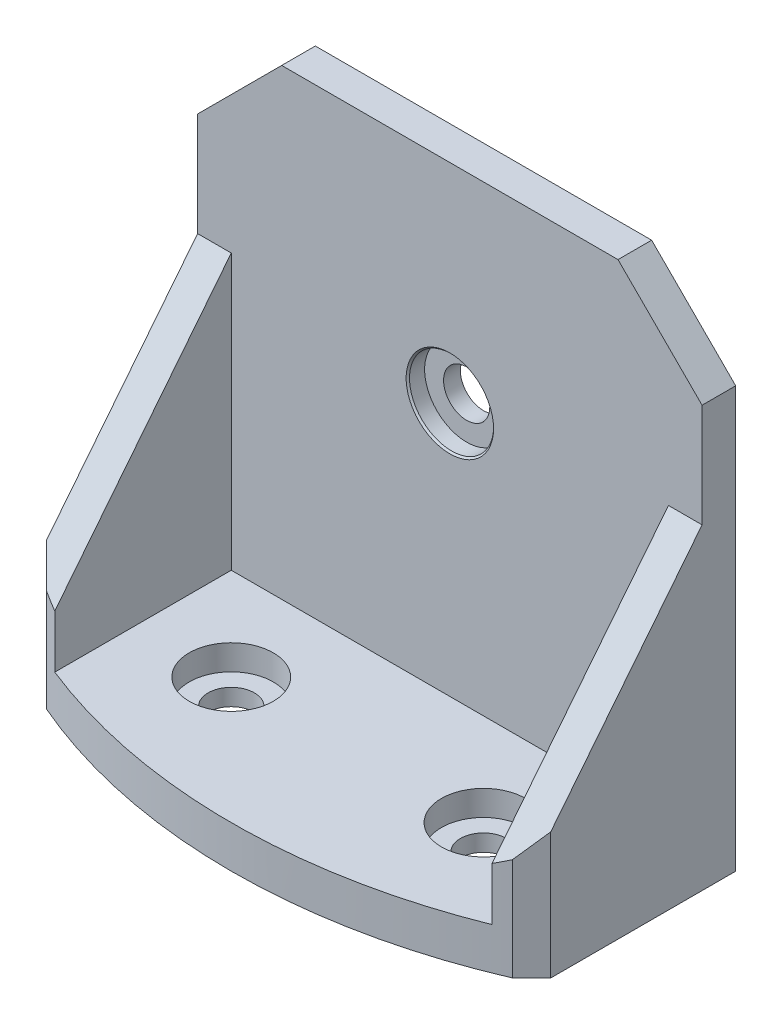
from build123d import *

# Parameters (mm, degrees)
SKETCH1_W                = 120
SKETCH1_H                = 30
BOSS_EXTRUDE1_DEPTH      = 100
CUT_EXTRUDE1_DEPTH       = 121.415945788
CUT_EXTRUDE1_DEPTH_BACK  = 121.415945788
SKETCH2_R                = 2.15
SKETCH2_W                = 20.1
SKETCH2_H                = 40.4
SKETCH3_OUTSIDE_W        = 153.812
SKETCH3_OUTSIDE_H        = 133.812
CUT_EXTRUDE2_DEPTH       = 121.415945788
CUT_EXTRUDE3_START       = -30
CUT_EXTRUDE3_DEPTH       = 30
SKETCH5_W                = 67.698745078
SKETCH5_H                = 100.8
CUT_EXTRUDE4_DEPTH       = 26
RIB1_REACH               = 122.416
SKETCH6_WALL_W           = 284.590065176
SKETCH6_WALL_H           = 4
RIB6_REACH               = 122.416
SKETCH7_WALL_W           = 284.590065176
SKETCH7_WALL_H           = 4
BOSS_EXTRUDE2_DEPTH      = 5
BOSS_EXTRUDE2_DEPTH_BACK = 4
SKETCH8_R                = 2.15
CUT_EXTRUDE5_DEPTH       = 84.326168543
CUT_EXTRUDE5_DEPTH_BACK  = 84.326168543
SKETCH9_R                = 2.75
SKETCH10_R               = 5
CUT_EXTRUDE6_DEPTH       = 3
CHAMFER1_SIZE            = 8
CUT_EXTRUDE7_START       = -12.194246874
CUT_EXTRUDE7_DEPTH       = 12.194246874
SKETCH12_W               = 37.282730079
SKETCH12_H               = 58.292887361
CUT_EXTRUDE8_DEPTH       = 108.591821251
SKETCH13_W               = 20.1
SKETCH13_H               = 40.4
BOSS_EXTRUDE3_DEPTH      = 4
SKETCH16_W               = 60
SKETCH16_H               = 40
BOSS_EXTRUDE4_DEPTH      = 4
CUT_EXTRUDE9_DEPTH       = 109.484577329
CUT_EXTRUDE9_DEPTH_BACK  = 109.484577329
SKETCH14_R               = 2.75
SKETCH15_R               = 5
CUT_EXTRUDE10_DEPTH      = 2
CHAMFER2_SIZE            = 0.2
CHAMFER3_SIZE            = 10
CUT_EXTRUDE11_DEPTH      = 109.484577329
CUT_EXTRUDE11_DEPTH_BACK = 109.484577329
CHAMFER4_SIZE            = 10


# Read off the part's stored shape, not the designer's step: Cut-Extrude3, Cut-Extrude7
with BuildPart() as part:
    # Sketch1 → Boss-Extrude1 (new body)
    with BuildSketch(Plane(origin=(0, 0, 0), x_dir=(1, 0, 0), z_dir=(0, 1, 0))):
        with Locations((0, -15)):
            Rectangle(SKETCH1_W, SKETCH1_H)
    extrude(amount=BOSS_EXTRUDE1_DEPTH)

    # Sketch2 → Cut-Extrude1 (cut, two sides: drawn at the far end of the back side and taken through both)
    with BuildSketch(Plane.XY.offset(30).offset(-CUT_EXTRUDE1_DEPTH_BACK)):
        with Locations((-4.95, 82.583541889)):
            Circle(SKETCH2_R)
        with Locations((4.95, 82.583541889)):
            Circle(SKETCH2_R)
        with Locations((-4.95, 34.383541889)):
            Circle(SKETCH2_R)
        with Locations((4.95, 34.383541889)):
            Circle(SKETCH2_R)
        with Locations((0, 58.483541889)):
            Rectangle(SKETCH2_W, SKETCH2_H)
    extrude(amount=CUT_EXTRUDE1_DEPTH + CUT_EXTRUDE1_DEPTH_BACK, mode=Mode.SUBTRACT)

    # Sketch3 outside → Cut-Extrude2 (cut, through all)
    with BuildSketch(Plane.XY.offset(30)):
        with Locations((0, 50)):
            Rectangle(SKETCH3_OUTSIDE_W, SKETCH3_OUTSIDE_H)
        with BuildLine():
            Line((-45, 23.283541889), (45, 23.283541889))
            Line((45, 23.283541889), (19.804596008, 86.568297014))
            ThreePointArc((19.804596008, 86.568297014), (0, 100), (-19.804596008, 86.568297014))
            Line((-19.804596008, 86.568297014), (-45, 23.283541889))
        make_face(mode=Mode.SUBTRACT)
    extrude(amount=-CUT_EXTRUDE2_DEPTH, mode=Mode.SUBTRACT)

    # Cut-Extrude3 outline → Cut-Extrude3 (cut)
    with BuildSketch(Plane.XY.offset(30).offset(CUT_EXTRUDE3_START)):
        Polygon((30, 60.95991045), (30, 23.283541889), (45, 23.283541889), align=None)
        Polygon((-30, 23.283541889), (-30, 60.95991045), (-45, 23.283541889), align=None)
    extrude(amount=CUT_EXTRUDE3_DEPTH, mode=Mode.SUBTRACT)

    # Sketch5 → Cut-Extrude4 (cut)
    with BuildSketch(Plane.XY.offset(30)):
        with Locations((0, 78.683541889)):
            Rectangle(SKETCH5_W, SKETCH5_H)
    extrude(amount=-CUT_EXTRUDE4_DEPTH, mode=Mode.SUBTRACT)

    # Sketch6 wall → Rib1 (add, up to next)
    with BuildSketch(Plane(origin=(-30, 44.62172617, 17), x_dir=(0, -0.782514313837, 0.622632595228), z_dir=(0, 0.622632595228, 0.782514313837)), mode=Mode.PRIVATE) as rib1_sk1:
        with Locations((0, 2)):
            Rectangle(SKETCH6_WALL_W, SKETCH6_WALL_H)
    rib1_tool1 = extrude(rib1_sk1.sketch, amount=-RIB1_REACH, mode=Mode.PRIVATE) - part.part
    add(rib1_tool1.solids().sort_by_distance((-30, 44.62172617, 17))[0])

    # Sketch7 wall → Rib6 (add, up to next)
    with BuildSketch(Plane(origin=(30, 44.62172617, 17), x_dir=(0, -0.782514313837, 0.622632595228), z_dir=(0, -0.622632595228, -0.782514313837)), mode=Mode.PRIVATE) as rib6_sk1:
        with Locations((0, 2)):
            Rectangle(SKETCH7_WALL_W, SKETCH7_WALL_H)
    rib6_tool1 = extrude(rib6_sk1.sketch, amount=RIB6_REACH, mode=Mode.PRIVATE) - part.part
    add(rib6_tool1.solids().sort_by_distance((30, 44.62172617, 17))[0])

    # Sketch8 → Boss-Extrude2 (add, two sides: drawn at the far end of the back side and taken through both)
    with BuildSketch(Plane.XY.offset(4).offset(-BOSS_EXTRUDE2_DEPTH_BACK)):
        with Locations((-4.95, 82.583541889)):
            Circle(SKETCH8_R)
        with Locations((4.95, 82.583541889)):
            Circle(SKETCH8_R)
        with Locations((-4.95, 34.383541889)):
            Circle(SKETCH8_R)
        with Locations((4.95, 34.383541889)):
            Circle(SKETCH8_R)
    extrude(amount=BOSS_EXTRUDE2_DEPTH + BOSS_EXTRUDE2_DEPTH_BACK)

    # Sketch9 → Cut-Extrude5 (cut, two sides: drawn at the far end of the back side and taken through both)
    with BuildSketch(Plane(origin=(0, 28.283541889, 0), x_dir=(1, 0, 0), z_dir=(0, 1, 0)).offset(-CUT_EXTRUDE5_DEPTH_BACK)):
        with Locations(Location((-15, -15, 0), (0, 0, 270))):
            Circle(SKETCH9_R)
        with Locations(Location((15, -15, 0), (0, 0, 270))):
            Circle(SKETCH9_R)
    extrude(amount=CUT_EXTRUDE5_DEPTH + CUT_EXTRUDE5_DEPTH_BACK, mode=Mode.SUBTRACT)

    # Sketch10 → Cut-Extrude6 (cut)
    with BuildSketch(Plane(origin=(0, 28.283541889, 0), x_dir=(1, 0, 0), z_dir=(0, 1, 0))):
        with Locations(Location((-15, -15, 0), (0, 0, 270))):
            Circle(SKETCH10_R)
        with Locations(Location((15, -15, 0), (0, 0, 270))):
            Circle(SKETCH10_R)
    extrude(amount=-CUT_EXTRUDE6_DEPTH, mode=Mode.SUBTRACT)

    # Chamfer1
    # the kernel refuses this chamfer: 8 mm, written as the material it takes off along each edge
    with BuildSketch(Plane(origin=(-30, 2.710077985, 30), x_dir=(-0.02749587661058658, 0, -0.9996219169112968), z_dir=(0, 1, 0))) as chamfer1_piece_1:
        Polygon((CHAMFER1_SIZE * 0.999621916911, -CHAMFER1_SIZE * 0.0274958766106), (-CHAMFER1_SIZE * 0.0274958766106, -CHAMFER1_SIZE * 0.999621916911), (0, 0), align=None)
    extrude(amount=46.146927807, mode=Mode.SUBTRACT)
    with BuildSketch(Plane(origin=(30, 48.857005793, 30), x_dir=(-0.9996219169112968, 0, 0.027495876610586487), z_dir=(0, -1, 0))) as chamfer1_piece_2:
        Polygon((CHAMFER1_SIZE * 0.999621916911, CHAMFER1_SIZE * 0.0274958766106), (-CHAMFER1_SIZE * 0.0274958766106, CHAMFER1_SIZE * 0.999621916911), (0, 0), align=None)
    extrude(amount=46.146927807, mode=Mode.SUBTRACT)

    # Cut-Extrude7 outline → Cut-Extrude7 (cut)
    with BuildSketch(Plane.XZ.offset(-23.283541889).offset(CUT_EXTRUDE7_START)):
        with BuildLine():
            ThreePointArc((-27.724333118, 24.275666882), (-14.154563191, 28.553981218), (0, 30))
            Line((0, 30), (-22, 30))
            Line((-22, 30), (-27.724333118, 24.275666882))
        make_face()
        with BuildLine():
            ThreePointArc((0, 30), (14.154563191, 28.553981218), (27.724333118, 24.275666882))
            Line((27.724333118, 24.275666882), (22, 30))
            Line((22, 30), (0, 30))
        make_face()
    extrude(amount=CUT_EXTRUDE7_DEPTH, mode=Mode.SUBTRACT)

    # Sketch12 → Cut-Extrude8 (cut, through all)
    with BuildSketch(Plane.XY.offset(4)):
        with Locations((-0.669441285, 59.375969669)):
            Rectangle(SKETCH12_W, SKETCH12_H)
    extrude(amount=CUT_EXTRUDE8_DEPTH, mode=Mode.SUBTRACT)

    # Sketch13 → Boss-Extrude3 (add)
    with BuildSketch(Plane.XY.offset(4)):
        with Locations((0, 58.483541889)):
            Rectangle(SKETCH13_W, SKETCH13_H)
    extrude(amount=-BOSS_EXTRUDE3_DEPTH)

    # Sketch16 → Boss-Extrude4 (add)
    with BuildSketch(Plane(origin=(0, 0, 0), x_dir=(-1, 0, 0), z_dir=(0, 0, -1))):
        with Locations((0, 80.95991045)):
            Rectangle(SKETCH16_W, SKETCH16_H)
    extrude(amount=-BOSS_EXTRUDE4_DEPTH)

    # Sketch14 → Cut-Extrude9 (cut, two sides: drawn at the far end of the back side and taken through both)
    with BuildSketch(Plane.XY.offset(4).offset(-CUT_EXTRUDE9_DEPTH_BACK)):
        with Locations((0, 58.473541889)):
            Circle(SKETCH14_R)
    extrude(amount=CUT_EXTRUDE9_DEPTH + CUT_EXTRUDE9_DEPTH_BACK, mode=Mode.SUBTRACT)

    # Sketch15 → Cut-Extrude10 (cut)
    with BuildSketch(Plane.XY.offset(4)):
        with Locations((0, 58.473541889)):
            Circle(SKETCH15_R)
    extrude(amount=-CUT_EXTRUDE10_DEPTH, mode=Mode.SUBTRACT)

    # Chamfer2
    chamfer2_edges = [part.edges().sort_by_distance(p)[0] for p in [
        (-5, 58.473541889, 4),
    ]]
    chamfer(chamfer2_edges, length=CHAMFER2_SIZE)

    # Chamfer3
    chamfer3_edges = [part.edges().sort_by_distance(p)[0] for p in [
        (30, 100.95991045, 2),
        (-30, 100.95991045, 2),
    ]]
    chamfer(chamfer3_edges, length=CHAMFER3_SIZE)

    # Sketch17 → Cut-Extrude11 (cut, two sides: drawn at the far end of the back side and taken through both)
    with BuildSketch(Plane.XY.offset(4).offset(-CUT_EXTRUDE11_DEPTH_BACK)):
        Polygon((-49.480687217, 83.283541889), (47.707933407, 83.283541889), (47.707933407, 123.775741613), (-59.194126739, 121.253008662), align=None)
    extrude(amount=CUT_EXTRUDE11_DEPTH + CUT_EXTRUDE11_DEPTH_BACK, mode=Mode.SUBTRACT)

    # Chamfer4
    chamfer4_edges = [part.edges().sort_by_distance(p)[0] for p in [
        (-30, 83.283541889, 2),
        (30, 83.283541889, 2),
    ]]
    chamfer(chamfer4_edges, length=CHAMFER4_SIZE)


solid = part.part
